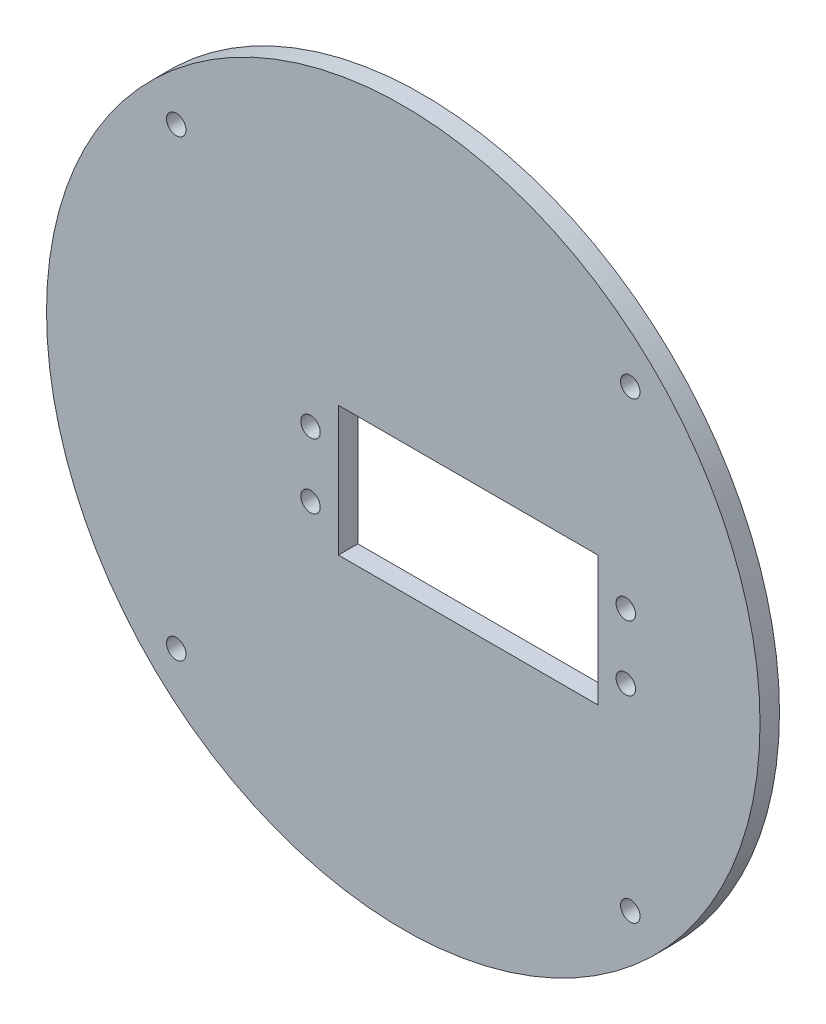
from build123d import *

# Parameters (mm, degrees)
SKETCH_1_R      = 55
SKETCH_1_R_2    = 1.5
SKETCH_1_W      = 40
SKETCH_1_H      = 20
EXTRUDE_2_DEPTH = 3


with BuildPart() as part:
    # 草图1 → 凸台-拉伸2 (new body)
    with BuildSketch(Plane.XY):
        Circle(SKETCH_1_R)
        with Locations((-35, -35)):
            Circle(SKETCH_1_R_2, mode=Mode.SUBTRACT)
        with Locations((35, -35)):
            Circle(SKETCH_1_R_2, mode=Mode.SUBTRACT)
        with Locations((35, 35)):
            Circle(SKETCH_1_R_2, mode=Mode.SUBTRACT)
        with Locations((-35, 35)):
            Circle(SKETCH_1_R_2, mode=Mode.SUBTRACT)
        with Locations((34.3, 5)):
            Circle(SKETCH_1_R_2, mode=Mode.SUBTRACT)
        with Locations((10, 0)):
            Rectangle(SKETCH_1_W, SKETCH_1_H, mode=Mode.SUBTRACT)
        with Locations((-14.3, 5)):
            Circle(SKETCH_1_R_2, mode=Mode.SUBTRACT)
        with Locations((-14.3, -5)):
            Circle(SKETCH_1_R_2, mode=Mode.SUBTRACT)
        with Locations((34.3, -5)):
            Circle(SKETCH_1_R_2, mode=Mode.SUBTRACT)
    extrude(amount=EXTRUDE_2_DEPTH)


solid = part.part
